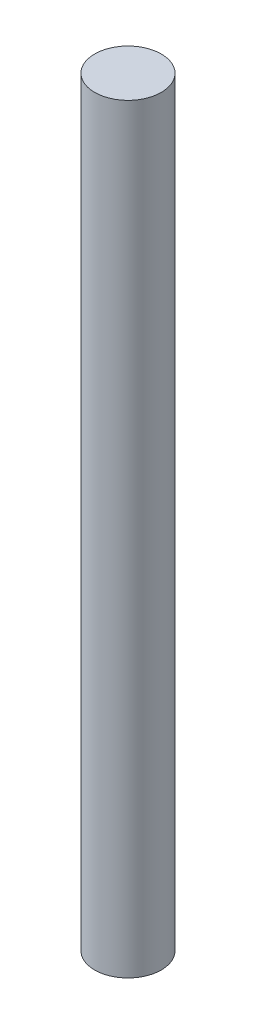
from build123d import *

# Parameters (mm, degrees)
SKETCH1_R           = 3.78
BOSS_EXTRUDE1_DEPTH = 86.3


with BuildPart() as part:
    # Sketch1 → Boss-Extrude1 (new body)
    with BuildSketch(Plane(origin=(0, 0, 0), x_dir=(1, 0, 0), z_dir=(0, 1, 0))):
        Circle(SKETCH1_R)
    extrude(amount=BOSS_EXTRUDE1_DEPTH)


solid = part.part
